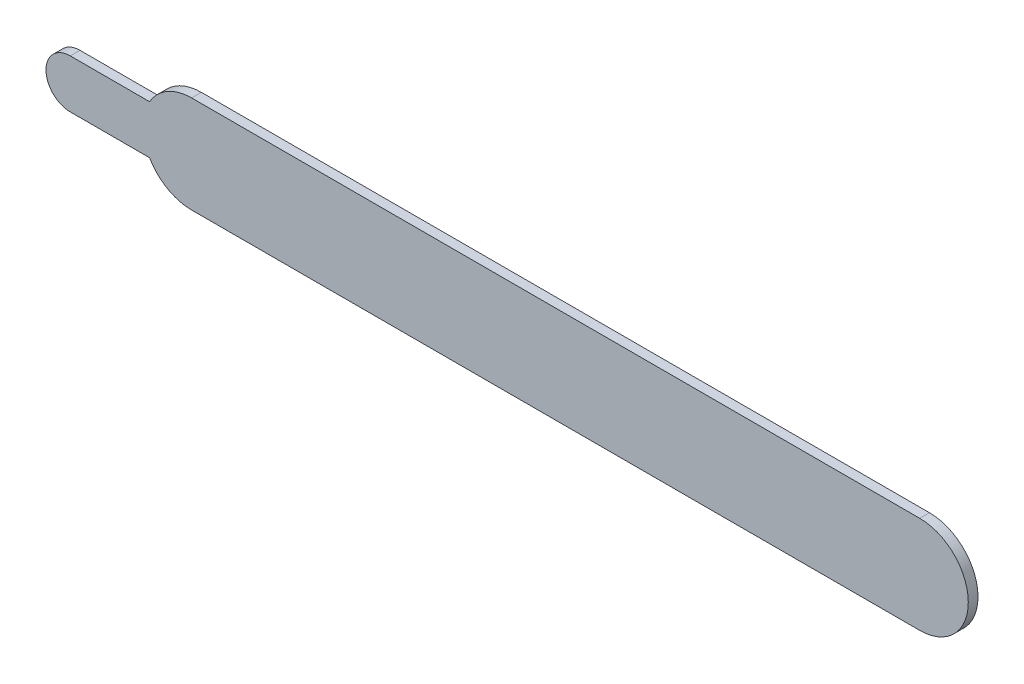
from build123d import *

# Parameters (mm, degrees)
BOSS_EXTRUDE1_DEPTH = 1


with BuildPart() as part:
    # Sketch1 → Boss-Extrude1 (new, symmetric)
    with BuildSketch(Plane.XY):
        with BuildLine():
            Line((0, 10), (150, 10))
            ThreePointArc((150, 10), (160, 0), (150, -10))
            Line((150, -10), (0, -10))
            ThreePointArc((0, -10), (-5.00000204, -8.66025286), (-8.660256393, -4.99999592))
            Line((-8.660256393, -4.99999592), (-25, -5))
            ThreePointArc((-25, -5), (-30, 0), (-25, 5))
            Line((-25, 5), (-8.660256485, 4.999995761))
            ThreePointArc((-8.660256485, 4.999995761), (-5.000002119, 8.660252814), (0, 10))
        make_face()
    extrude(amount=BOSS_EXTRUDE1_DEPTH, both=True)


solid = part.part
